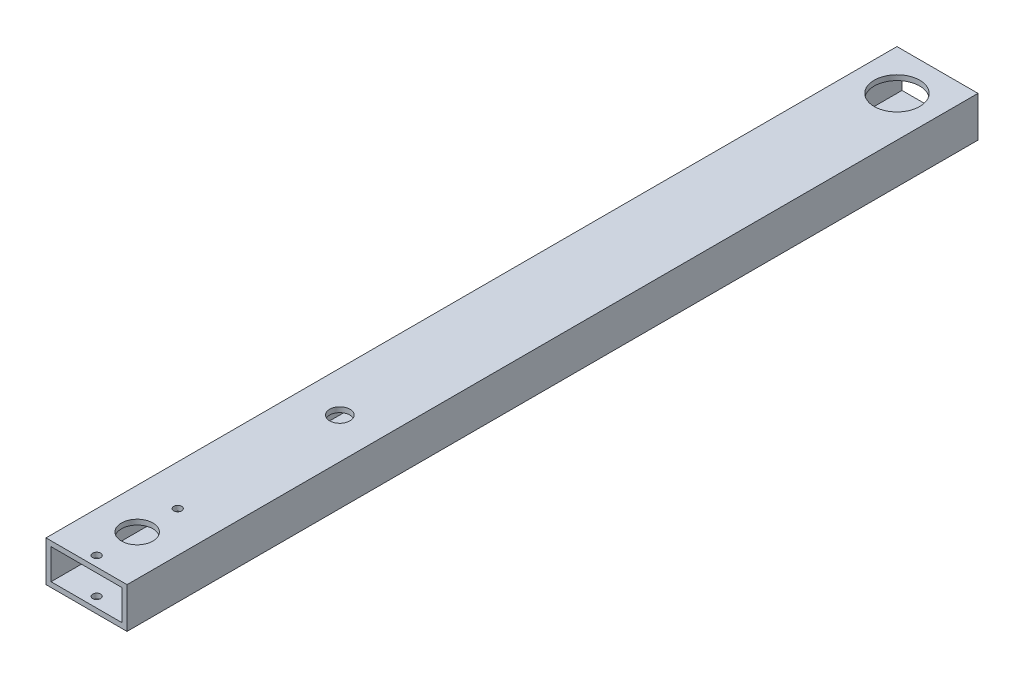
from build123d import *

# Parameters (mm, degrees)
SKETCH1_W           = 50.8
SKETCH1_H           = 25.4
BOSS_EXTRUDE1_DEPTH = 266.7
SKETCH2_W           = 44.45
SKETCH2_H           = 19.05
CUT_EXTRUDE1_DEPTH  = 535.155417458
SKETCH5_R           = 2.4892
SKETCH5_R_2         = 9.84885
SKETCH5_R_3         = 14.2875
CUT_EXTRUDE2_DEPTH  = 508
SKETCH7_R           = 6.35
CUT_EXTRUDE4_DEPTH  = 270.108175275


with BuildPart() as part:
    # Sketch1 → Boss-Extrude1 (new, symmetric)
    with BuildSketch(Plane.XY):
        Rectangle(SKETCH1_W, SKETCH1_H)
    extrude(amount=BOSS_EXTRUDE1_DEPTH, both=True)

    # Sketch2 → Cut-Extrude1 (cut, through all)
    with BuildSketch(Plane.XY.offset(266.7)):
        Rectangle(SKETCH2_W, SKETCH2_H)
    extrude(amount=-CUT_EXTRUDE1_DEPTH, mode=Mode.SUBTRACT)

    # Sketch5 → Cut-Extrude2 (cut)
    with BuildSketch(Plane(origin=(0, 12.7, 0), x_dir=(1, 0, 0), z_dir=(0, 1, 0))):
        with Locations((0, -260.35)):
            Circle(SKETCH5_R)
        with Locations((0, -234.95)):
            Circle(SKETCH5_R_2)
        with Locations((0, -209.55)):
            Circle(SKETCH5_R)
        with Locations((0, 241.3)):
            Circle(SKETCH5_R_3)
    extrude(amount=-CUT_EXTRUDE2_DEPTH, mode=Mode.SUBTRACT)

    # Sketch7 → Cut-Extrude4 (cut, through all)
    with BuildSketch(Plane(origin=(0, 12.7, 0), x_dir=(1, 0, 0), z_dir=(0, 1, 0))):
        with Locations((0, -107.95)):
            Circle(SKETCH7_R)
    extrude(amount=-CUT_EXTRUDE4_DEPTH, mode=Mode.SUBTRACT)


solid = part.part
